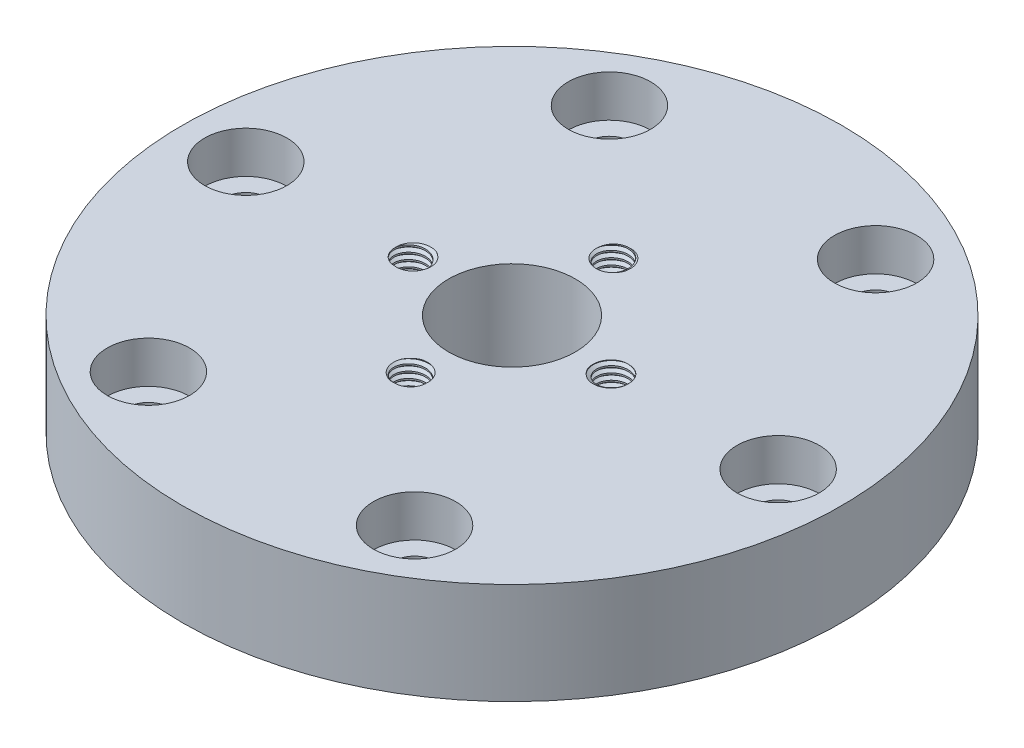
from build123d import *

# Parameters (mm, degrees)
SKETCH1_R           = 26
SKETCH1_R_2         = 5
BOSS_EXTRUDE1_DEPTH = 8
SKETCH2_R           = 1.25
SKETCH2_R_2         = 1.7
CUT_EXTRUDE1_DEPTH  = 38.629775444
SKETCH3_R           = 3.25
CUT_EXTRUDE2_DEPTH  = 3.3
THREAD1_PITCH       = 0.5
CIRPATTERN1_COUNT   = 4


with BuildPart() as part:
    # Sketch1 → Boss-Extrude1 (new body)
    with BuildSketch(Plane(origin=(0, 0, 0), x_dir=(1, 0, 0), z_dir=(0, 1, 0))):
        with Locations(Location((0, 0, 0), (0, 0, 270))):
            Circle(SKETCH1_R)
        with Locations(Location((0, 0, 0), (0, 0, 270))):
            Circle(SKETCH1_R_2, mode=Mode.SUBTRACT)
    extrude(amount=BOSS_EXTRUDE1_DEPTH)

    # Sketch2 → Cut-Extrude1 (cut, through all)
    with BuildSketch(Plane(origin=(0, 8, 0), x_dir=(1, 0, 0), z_dir=(0, 1, 0))):
        with Locations(Location((0, 8, 0), (0, 0, 270))):
            Circle(SKETCH2_R)
        with Locations(Location((-21, 0, 0), (0, 0, 270))):
            Circle(SKETCH2_R_2)
        with Locations(Location((8, 0, 0), (0, 0, 270))):
            Circle(SKETCH2_R)
        with Locations(Location((0, -8, 0), (0, 0, 270))):
            Circle(SKETCH2_R)
        with Locations(Location((-8, 0, 0), (0, 0, 270))):
            Circle(SKETCH2_R)
        with Locations(Location((-10.5, 18.186533479, 0), (0, 0, 270))):
            Circle(SKETCH2_R_2)
        with Locations(Location((10.5, 18.186533479, 0), (0, 0, 270))):
            Circle(SKETCH2_R_2)
        with Locations(Location((21, 0, 0), (0, 0, 270))):
            Circle(SKETCH2_R_2)
        with Locations(Location((10.5, -18.186533479, 0), (0, 0, 270))):
            Circle(SKETCH2_R_2)
        with Locations(Location((-10.5, -18.186533479, 0), (0, 0, 270))):
            Circle(SKETCH2_R_2)
    extrude(amount=-CUT_EXTRUDE1_DEPTH, mode=Mode.SUBTRACT)

    # Sketch3 → Cut-Extrude2 (cut)
    with BuildSketch(Plane(origin=(0, 8, 0), x_dir=(1, 0, 0), z_dir=(0, 1, 0))):
        with Locations(Location((-21, 0, 0), (0, 0, 270))):
            Circle(SKETCH3_R)
        with Locations(Location((-10.5, 18.186533479, 0), (0, 0, 270))):
            Circle(SKETCH3_R)
        with Locations(Location((10.5, 18.186533479, 0), (0, 0, 270))):
            Circle(SKETCH3_R)
        with Locations(Location((21, 0, 0), (0, 0, 270))):
            Circle(SKETCH3_R)
        with Locations(Location((10.5, -18.186533479, 0), (0, 0, 270))):
            Circle(SKETCH3_R)
        with Locations(Location((-10.5, -18.186533479, 0), (0, 0, 270))):
            Circle(SKETCH3_R)
    extrude(amount=-CUT_EXTRUDE2_DEPTH, mode=Mode.SUBTRACT)

    # Thread1: the profile of Thread Profile1 profile screwed along a right-hand helix of 18 turns, 6 arcs to a turn; built about Z, then put on its axis
    thread1_z = Axis((0, 0, 0), (0, 0, 1))
    thread1_corners = [(1.2497, 0, -0.000173205), (1.520632938, 0, 0.156249999), (1.520632937, 0, 0.218749999), (1.2497, 0, 0.375173204)]
    with BuildLine(mode=Mode.PRIVATE) as thread1_profile:
        Line(thread1_corners[0], thread1_corners[1])
        Line(thread1_corners[1], thread1_corners[2])
        Line(thread1_corners[2], thread1_corners[3])
        Line(thread1_corners[3], thread1_corners[0])
    thread1_cap = Face(thread1_profile.wire())
    thread1_turn_angles = [0, 30, 60, 90, 120, 150, 180, 210, 240, 270, 300, 330, 360]
    thread1_turn_weights = [1, 0.8660254037844387, 1, 0.8660254037844387, 1, 0.8660254037844387, 1, 0.8660254037844387, 1, 0.8660254037844387, 1, 0.8660254037844387, 1]
    thread1_turn_rails = [Edge.make_bspline([Vector(p[0], p[1], 0).rotate(thread1_z, thread1_turn_angles[k]) / thread1_turn_weights[k] + Vector(0, 0, p[2] + THREAD1_PITCH * thread1_turn_angles[k] / 360) for k in range(13)], [0, 0, 0, 1, 1, 2, 2, 3, 3, 4, 4, 5, 5, 6, 6, 6], 2, thread1_turn_weights) for p in thread1_corners]
    thread1_turn_sides = [Face.make_surface_from_curves(thread1_turn_rails[p[0]], thread1_turn_rails[p[1]]) for p in [(0, 1), (1, 2), (2, 3), (3, 0)]]
    thread1 = Plane(origin=(0, 9, -8), x_dir=(-1, 0, 0), z_dir=(0, -1, 0)) * Solid(Shell([*[p.moved(Location((0, 0, THREAD1_PITCH * i))) for i in range(18) for p in thread1_turn_sides], thread1_cap, thread1_cap.rotate(thread1_z, 6480).moved(Location((0, 0, THREAD1_PITCH * 6480 / 360)))]))
    add(thread1, mode=Mode.SUBTRACT)

    # CirPattern1: Thread1 ×4 about axis
    cirpattern1_axis = Axis((0, 8, 0), (0, -1, 0))
    for i in range(1, CIRPATTERN1_COUNT):
        add(thread1.rotate(cirpattern1_axis, i * 360 / CIRPATTERN1_COUNT), mode=Mode.SUBTRACT)


solid = part.part
